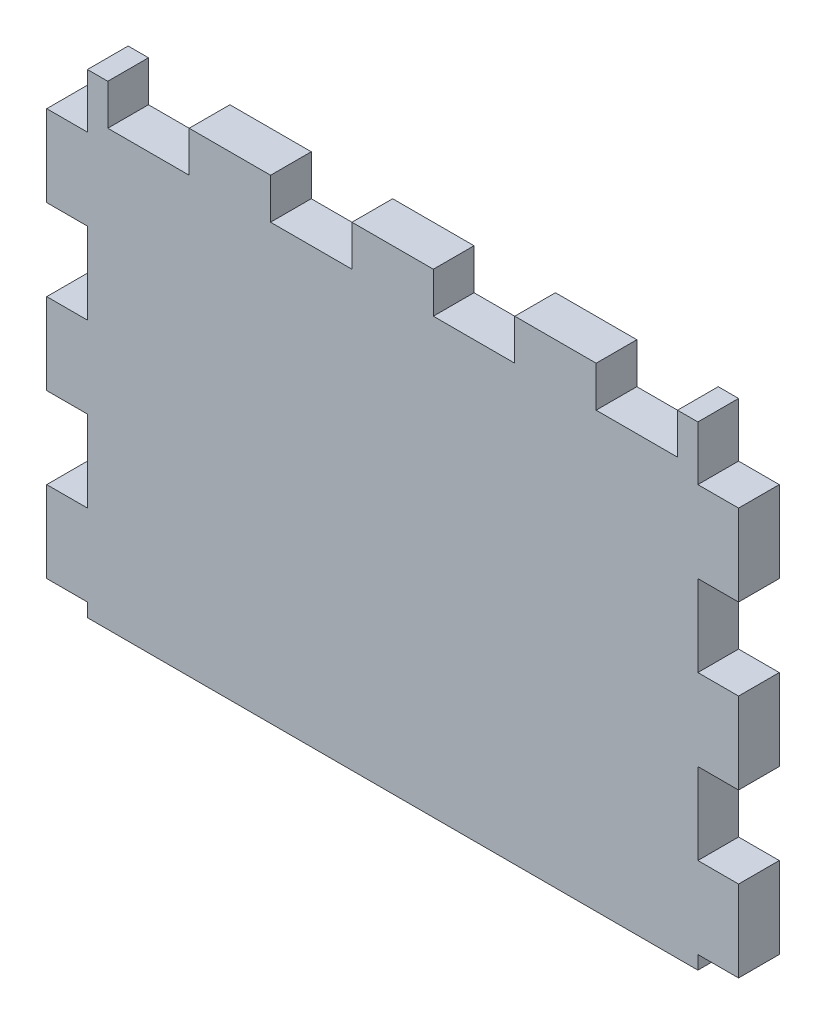
from build123d import *

# Parameters (mm, degrees)
SKETCH1_W               = 45
SKETCH1_H               = 32
BOSS_EXTRUDE1_DEPTH     = 3
SKETCH2_W               = 3
SKETCH2_H               = 6
BOSS_EXTRUDE2_DEPTH     = 3
LPATTERN1_COUNT         = 2
LPATTERN1_PITCH         = 12
LPATTERN1_COL_COUNT     = 2
LPATTERN1_COL_PITCH     = 12
SKETCH3_W               = 6
SKETCH3_H               = 3
BOSS_EXTRUDE3_DEPTH     = 3
LPATTERN2_COUNT         = 3
LPATTERN2_PITCH         = 12
LPATTERN2_COL_COUNT     = 3
LPATTERN2_COL_PITCH     = 12
SKETCH5_W               = 4.5
SKETCH5_H               = 3
CUT_EXTRUDE1_DEPTH      = 3
MIRROR1_COPY_1_SKETCH_W = 3
MIRROR1_COPY_1_SKETCH_H = 6
MIRROR1_COPY_1_DEPTH    = 3
MIRROR1_COPY_2_SKETCH_W = 3
MIRROR1_COPY_2_SKETCH_H = 6
MIRROR1_COPY_2_DEPTH    = 3
MIRROR1_COPY_3_SKETCH_W = 3
MIRROR1_COPY_3_SKETCH_H = 6
MIRROR1_COPY_3_DEPTH    = 3


with BuildPart() as part:
    # Sketch1 → Boss-Extrude1 (new body)
    with BuildSketch(Plane.XY):
        Rectangle(SKETCH1_W, SKETCH1_H)
    extrude(amount=BOSS_EXTRUDE1_DEPTH)

    # Sketch2 → Boss-Extrude2 (add)
    with BuildSketch(Plane.ZY.offset(22.5)):
        with Locations((1.5, 0)):
            Rectangle(SKETCH2_W, SKETCH2_H)
    boss_extrude2 = extrude(amount=BOSS_EXTRUDE2_DEPTH)

    # LPattern1: Boss-Extrude2 ×2
    with Locations(*[(0, -i * LPATTERN1_PITCH, 0) for i in range(1, LPATTERN1_COUNT)]):
        add(boss_extrude2)

    # LPattern1 col: Boss-Extrude2 ×2
    with Locations(*[(0, i * LPATTERN1_COL_PITCH, 0) for i in range(1, LPATTERN1_COL_COUNT)]):
        add(boss_extrude2)

    # Sketch3 → Boss-Extrude3 (add)
    with BuildSketch(Plane(origin=(0, 16, 0), x_dir=(1, 0, 0), z_dir=(0, 1, 0))):
        with Locations((0, -1.5)):
            Rectangle(SKETCH3_W, SKETCH3_H)
    boss_extrude3 = extrude(amount=BOSS_EXTRUDE3_DEPTH)

    # LPattern2: Boss-Extrude3 ×3
    with Locations(*[(-i * LPATTERN2_PITCH, 0, 0) for i in range(1, LPATTERN2_COUNT)]):
        add(boss_extrude3)

    # LPattern2 col: Boss-Extrude3 ×3
    with Locations(*[(i * LPATTERN2_COL_PITCH, 0, 0) for i in range(1, LPATTERN2_COL_COUNT)]):
        add(boss_extrude3)

    # Sketch5 → Cut-Extrude1 (cut)
    with BuildSketch(Plane(origin=(0, 0, 0), x_dir=(-1, 0, 0), z_dir=(0, 0, -1))):
        with Locations((24.75, 17.5)):
            Rectangle(SKETCH5_W, SKETCH5_H)
    cut_extrude1 = extrude(amount=-CUT_EXTRUDE1_DEPTH, mode=Mode.SUBTRACT)

    # Mirror1 copy 1 sketch → Mirror1 copy 1 (add)
    with BuildSketch(Plane(origin=(22.5, -12, 0), x_dir=(0, 0, 1), z_dir=(1, 0, 0))):
        with Locations((1.5, 0)):
            Rectangle(MIRROR1_COPY_1_SKETCH_W, MIRROR1_COPY_1_SKETCH_H)
    extrude(amount=MIRROR1_COPY_1_DEPTH)

    # Mirror1 copy 2 sketch → Mirror1 copy 2 (add)
    with BuildSketch(Plane(origin=(22.5, 12, 0), x_dir=(0, 0, 1), z_dir=(1, 0, 0))):
        with Locations((1.5, 0)):
            Rectangle(MIRROR1_COPY_2_SKETCH_W, MIRROR1_COPY_2_SKETCH_H)
    extrude(amount=MIRROR1_COPY_2_DEPTH)

    # Mirror1 copy 3 sketch → Mirror1 copy 3 (add)
    with BuildSketch(Plane(origin=(22.5, 0, 0), x_dir=(0, 0, 1), z_dir=(1, 0, 0))):
        with Locations((1.5, 0)):
            Rectangle(MIRROR1_COPY_3_SKETCH_W, MIRROR1_COPY_3_SKETCH_H)
    extrude(amount=MIRROR1_COPY_3_DEPTH)

    # Mirror2: Cut-Extrude1 across plane
    add(cut_extrude1.mirror(Plane(origin=(0, 0, 0), x_dir=(0, 0, 1), z_dir=(1, 0, 0))), mode=Mode.SUBTRACT)


solid = part.part
